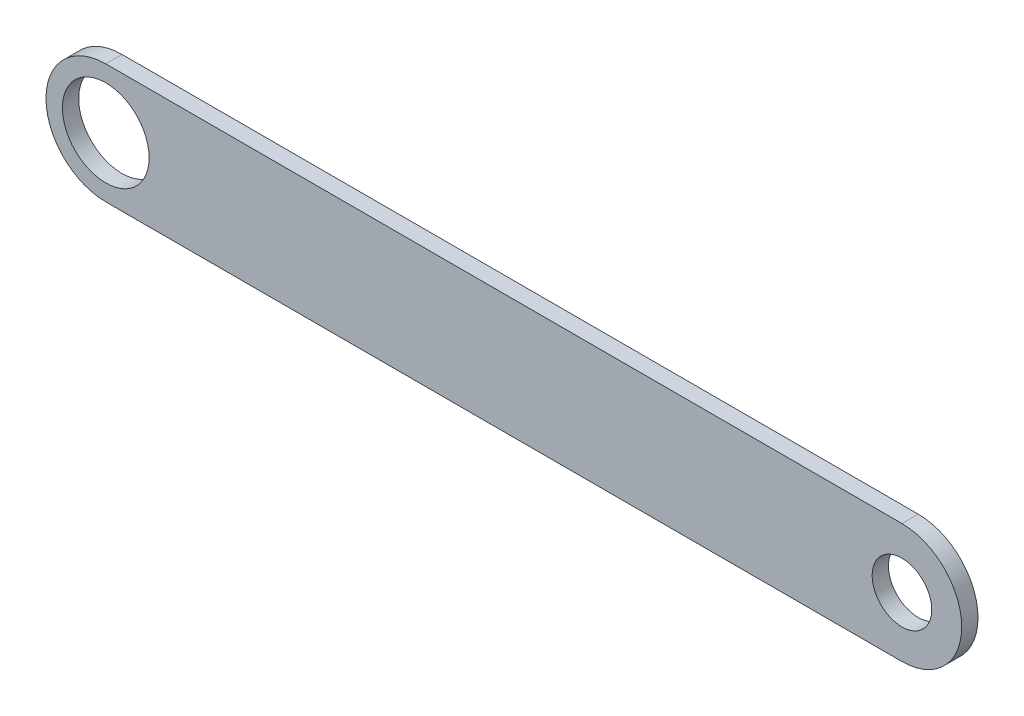
from build123d import *

# Parameters (mm, degrees)
SKETCH1_R           = 7.985
SKETCH1_R_2         = 5.485
BOSS_EXTRUDE1_DEPTH = 3


with BuildPart() as part:
    # Sketch1 → Boss-Extrude1 (new body)
    with BuildSketch(Plane.XY):
        with BuildLine():
            Line((-73.275, 11), (73.275, 11))
            ThreePointArc((73.275, 11), (84.275, 0), (73.275, -11))
            Line((73.275, -11), (-73.275, -11))
            ThreePointArc((-73.275, -11), (-84.275, 0), (-73.275, 11))
        make_face()
        with Locations((-73.275, 0)):
            Circle(SKETCH1_R, mode=Mode.SUBTRACT)
        with Locations((73.275, 0)):
            Circle(SKETCH1_R_2, mode=Mode.SUBTRACT)
    extrude(amount=BOSS_EXTRUDE1_DEPTH)


solid = part.part
